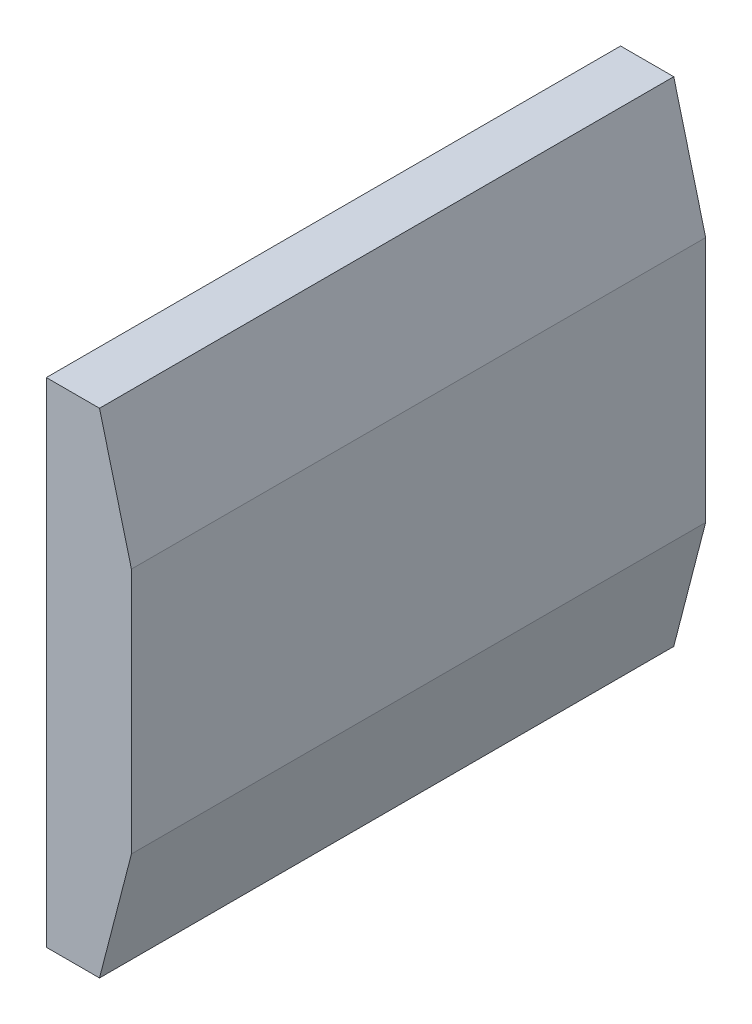
from build123d import *

# Parameters (mm, degrees)
BOSS_EXTRUDE1_DEPTH      = 67.5
BOSS_EXTRUDE1_DEPTH_BACK = 67.5


with BuildPart() as part:
    # Sketch1 → Boss-Extrude1 (new, two sides: drawn at the far end of the back side and taken through both)
    with BuildSketch(Plane.XY.offset(-BOSS_EXTRUDE1_DEPTH_BACK)):
        Polygon((0, 0), (0, -116), (12.5, -116), (20, -87), (20, -29), (12.5, 0), align=None)
    extrude(amount=BOSS_EXTRUDE1_DEPTH + BOSS_EXTRUDE1_DEPTH_BACK)


solid = part.part
